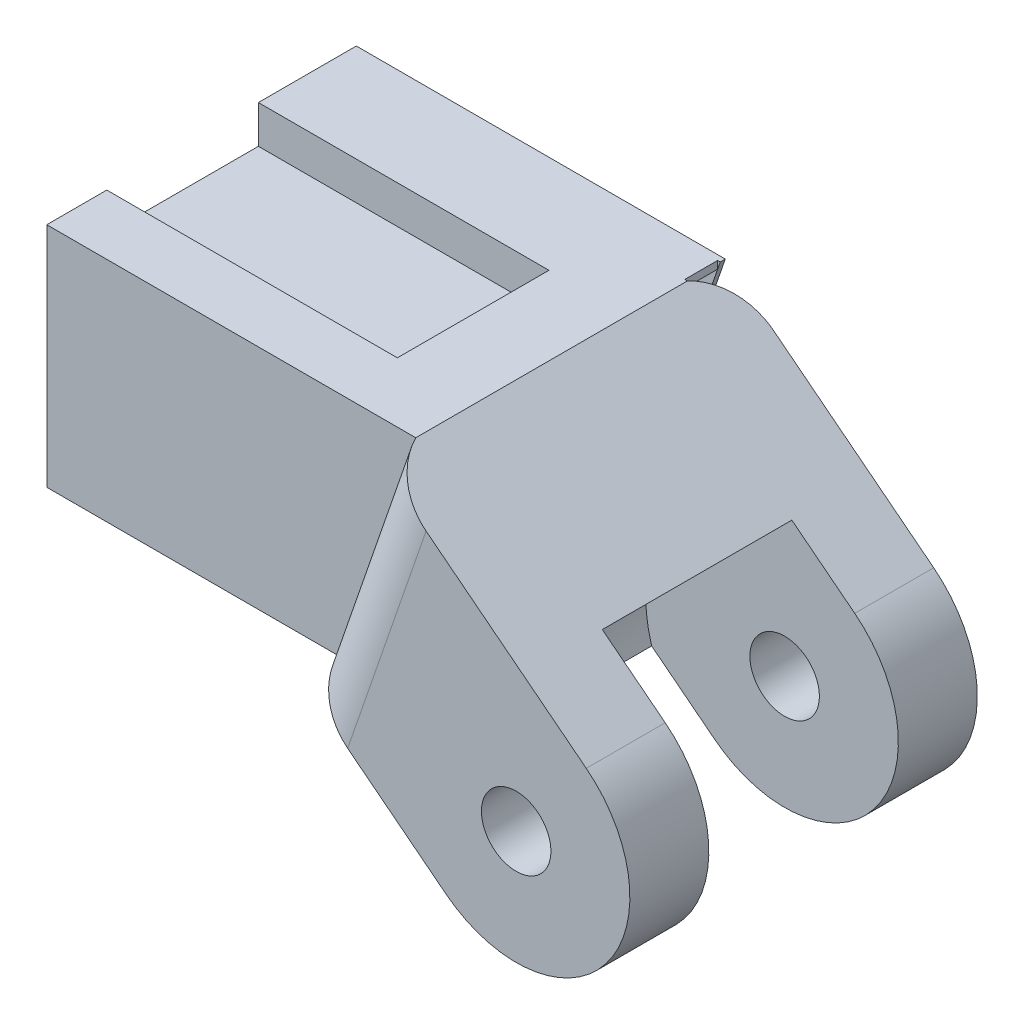
from build123d import *

# Parameters (mm, degrees)
BOSS_EXTRUDE1_DEPTH  = 5
BOSS_EXTRUDE7_DEPTH  = 5.75
BOSS_EXTRUDE8_START  = -3
BOSS_EXTRUDE8_DEPTH  = 3
SKETCH15_R           = 2.75
CUT_EXTRUDE7_DEPTH   = 46.783095044
FILLET2_R            = 5
SKETCH16_W           = 12
SKETCH16_H           = 3
CUT_EXTRUDE8_DEPTH   = 23
SKETCH17_R           = 2.35
CUT_EXTRUDE9_DEPTH   = 32
CUT_EXTRUDE11_START  = -8
CUT_EXTRUDE11_DEPTH  = 3.8
LPATTERN1_COUNT      = 2
LPATTERN1_PITCH      = 10
SKETCH26_R           = 11
CUT_EXTRUDE12_DEPTH  = 7.5
SKETCH28_W           = 29.000715486
SKETCH28_H           = 0.6
SKETCH28_W_2         = 23
SKETCH28_W_3         = 27.103937603
SKETCH28_W_4         = 25.207159719
BOSS_EXTRUDE9_DEPTH  = 3
BOSS_EXTRUDE10_DEPTH = 0.4


with BuildPart() as part:
    # Sketch1 → Boss-Extrude1 (new body)
    with BuildSketch(Plane.XY):
        with BuildLine():
            Line((-40.155138696, -0.836255417), (-17.155138696, -0.836255417))
            Line((-17.155138696, -0.836255417), (-5.547811002, -9.922989015))
            ThreePointArc((-5.547811002, -9.922989015), (7.086733598, -8.384066419), (5.547811002, 4.250478181))
            Line((5.547811002, 4.250478181), (-10.947501986, 17.163744583))
            Line((-10.947501986, 17.163744583), (-40.155138696, 17.163744583))
            Line((-40.155138696, 17.163744583), (-40.155138696, -0.836255417))
        make_face()
    extrude(amount=BOSS_EXTRUDE1_DEPTH)

    # Sketch14 → Boss-Extrude7 (add)
    with BuildSketch(Plane.XY.offset(5)):
        with BuildLine():
            Line((-40.155138696, -0.836255417), (-40.155138696, 17.163744583))
            Line((-40.155138696, 17.163744583), (-10.947501986, 17.163744583))
            Line((-10.947501986, 17.163744583), (5.547811002, 4.250478181))
            ThreePointArc((5.547811002, 4.250478181), (7.086733598, -8.384066419), (-5.547811002, -9.922989015))
            Line((-5.547811002, -9.922989015), (-17.155138696, -0.836255417))
            Line((-17.155138696, -0.836255417), (-40.155138696, -0.836255417))
        make_face()
    extrude(amount=BOSS_EXTRUDE7_DEPTH)

    # Sketch27 → Boss-Extrude8 (add)
    with BuildSketch(Plane.XY.offset(BOSS_EXTRUDE8_START)):
        with BuildLine():
            Line((-17.155138696, -0.836255417), (-10.947501986, 17.163744583))
            Line((-10.947501986, 17.163744583), (5.547811002, 4.250478181))
            ThreePointArc((5.547811002, 4.250478181), (7.086733598, -8.384066419), (-5.547811002, -9.922989015))
            Line((-5.547811002, -9.922989015), (-17.155138696, -0.836255417))
        make_face()
    extrude(amount=BOSS_EXTRUDE8_DEPTH)

    # Sketch15 → Cut-Extrude7 (cut, through all)
    with BuildSketch(Plane(origin=(0, 0, -3), x_dir=(-1, 0, 0), z_dir=(0, 0, -1))):
        with Locations((0, -2.836255417)):
            Circle(SKETCH15_R)
    extrude(amount=-CUT_EXTRUDE7_DEPTH, mode=Mode.SUBTRACT)

    # Fillet2
    # the kernel refuses this fillet: 5 mm, written as the material it takes off along each edge
    with BuildSketch(Plane(origin=(-20.89022917, -11.666726282, -3), x_dir=(0.9453610009462032, -0.32602542522016986, 0), z_dir=(0.3260254252201699, 0.9453610009462033, 0))) as fillet2_piece_1:
        with BuildLine():
            CenterArc((4.582575695, -5), FILLET2_R, 90, 66.421821522)
            Line((0, -3), (-0.091651514, -2.96))
            ThreePointArc((-0.091651514, -2.96), (-0.1, -1.5), (-0.1, 0))
            Line((-0.1, 0), (0, 0.1))
            Line((0, 0.1), (4.582575695, 0.1))
            Line((4.582575695, 0.1), (4.582575695, 0))
        make_face()
    extrude(amount=41.95322389, mode=Mode.SUBTRACT)

    # Mirror1: part across plane


with BuildPart() as part_1:
    add(part.part)
    add(part.part.mirror(Plane(origin=(0, -2.836255417, 10.75), x_dir=(1, 0, 0), z_dir=(0, 0, 1))))

    # Sketch16 → Cut-Extrude8 (cut)
    with BuildSketch(Plane.ZY.offset(40.155138696)):
        with Locations((10.75, 0.663744583)):
            Rectangle(SKETCH16_W, SKETCH16_H)
        with Locations((10.75, 15.663744583)):
            Rectangle(SKETCH16_W, SKETCH16_H)
    extrude(amount=-CUT_EXTRUDE8_DEPTH, mode=Mode.SUBTRACT)

    # Sketch17 → Cut-Extrude9 (cut)
    with BuildSketch(Plane.ZY.offset(40.155138696)):
        with Locations((10.75, 8.163744583)):
            Circle(SKETCH17_R)
    extrude(amount=-CUT_EXTRUDE9_DEPTH, mode=Mode.SUBTRACT)

    # Sketch20 → Cut-Extrude11 (cut)
    with BuildSketch(Plane.ZY.offset(40.155138696).offset(CUT_EXTRUDE11_START)):
        Polygon((14.5, 2.163744583), (14.5, 5.998681073), (10.75, 3.833617564), (7, 5.998681073), (7, 2.163744583), align=None)
        Polygon((10.75, 3.833617564), (14.5, 5.998681073), (14.5, 10.328808092), (10.75, 12.493871602), (7, 10.328808092), (7, 5.998681073), align=None)
    cut_extrude11 = extrude(amount=-CUT_EXTRUDE11_DEPTH, mode=Mode.SUBTRACT)

    # LPattern1: Cut-Extrude11 ×2
    with Locations(*[(i * LPATTERN1_PITCH, 0, 0) for i in range(1, LPATTERN1_COUNT)]):
        add(cut_extrude11, mode=Mode.SUBTRACT)

    # Sketch26 → Cut-Extrude12 (cut, symmetric)
    with BuildSketch(Plane.XY.offset(10.75)):
        with Locations((0, -2.836255417)):
            Circle(SKETCH26_R)
    extrude(amount=CUT_EXTRUDE12_DEPTH, both=True, mode=Mode.SUBTRACT)

    # Sketch28 → Boss-Extrude9 (add)
    with BuildSketch(Plane(origin=(0, 0, -3), x_dir=(-1, 0, 0), z_dir=(0, 0, -1))):
        with Locations((25.654780953, 16.863744583)):
            Rectangle(SKETCH28_W, SKETCH28_H)
        with Locations((28.655138696, -0.536255417)):
            Rectangle(SKETCH28_W_2, SKETCH28_H)
        with Locations((26.603169895, 11.363744583)):
            Rectangle(SKETCH28_W_3, SKETCH28_H)
        with Locations((27.551558836, 5.863744583)):
            Rectangle(SKETCH28_W_4, SKETCH28_H)
    extrude(amount=-BOSS_EXTRUDE9_DEPTH)

    # Sketch29 → Boss-Extrude10 (add)
    with BuildSketch(Plane(origin=(0, 0, -3), x_dir=(-1, 0, 0), z_dir=(0, 0, -1))):
        Polygon((40.155138696, 17.163744583), (40.155138696, -0.836255417), (17.155138696, -0.836255417), (11.15442321, 16.563744583), (10.947501986, 17.163744583), align=None)
    extrude(amount=-BOSS_EXTRUDE10_DEPTH)


solid = part_1.part
